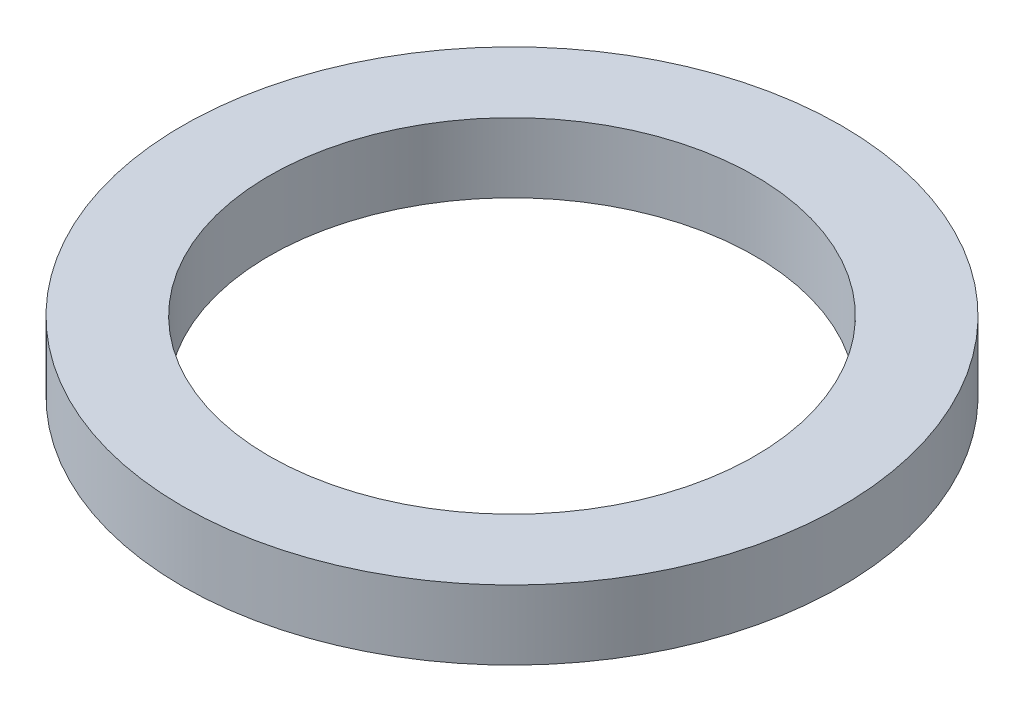
from build123d import *

# Parameters (mm, degrees)
SKETCH_1_R      = 47.5
SKETCH_1_R_2    = 35
EXTRUDE_1_DEPTH = 10


with BuildPart() as part:
    # 草圖1 → 填料-伸長1 (new body)
    with BuildSketch(Plane(origin=(0, 0, 0), x_dir=(1, 0, 0), z_dir=(0, 1, 0))):
        Circle(SKETCH_1_R)
        Circle(SKETCH_1_R_2, mode=Mode.SUBTRACT)
    extrude(amount=EXTRUDE_1_DEPTH)


solid = part.part
